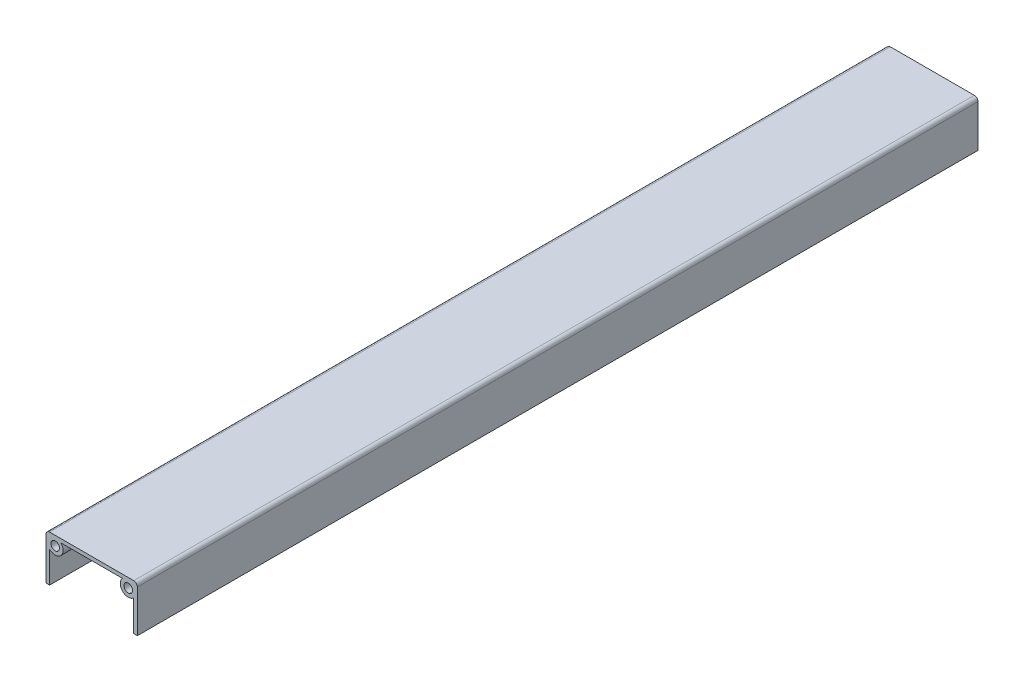
from build123d import *

# Parameters (mm, degrees)
SKETCH1_W           = 63.5
SKETCH1_H           = 63.5
SKETCH1_R           = 3
BOSS_EXTRUDE1_DEPTH = 292.1
FILLET1_R           = 2.54
SHELL1_START        = -292.1
SHELL1_DEPTH        = 584.2
SKETCH3_W           = 63.665273771
SKETCH3_H           = 31.75
CUT_EXTRUDE2_DEPTH  = 586.923002621


# Read off the part's stored shape, not the designer's step: Shell1
with BuildPart() as part:
    # Sketch1 → Boss-Extrude1 (new, symmetric)
    with BuildSketch(Plane.XY):
        Rectangle(SKETCH1_W, SKETCH1_H)
        with Locations((-25.4, 25.4)):
            Circle(SKETCH1_R, mode=Mode.SUBTRACT)
        with Locations(Location((25.4, -25.4, 0), (0, 0, 180))):
            Circle(SKETCH1_R, mode=Mode.SUBTRACT)
        with Locations(Location((-25.4, -25.4, 0), (0, 0, 180))):
            Circle(SKETCH1_R, mode=Mode.SUBTRACT)
        with Locations(Location((25.4, 25.4, 0), (0, 0, 180))):
            Circle(SKETCH1_R, mode=Mode.SUBTRACT)
    extrude(amount=BOSS_EXTRUDE1_DEPTH, both=True)

    # Fillet1
    fillet1_edges = [part.edges().sort_by_distance(p)[0] for p in [
        (31.75, -31.75, 0),
        (-31.75, -31.75, 0),
        (-31.75, 31.75, 0),
        (31.75, 31.75, 0),
    ]]
    fillet(fillet1_edges, radius=FILLET1_R)

    # Shell1 outline → Shell1 (cut)
    with BuildSketch(Plane.XY.offset(SHELL1_START)):
        with BuildLine():
            Line((29.21, -21.378122329), (29.21, 21.378122329))
            ThreePointArc((29.21, 21.378122329), (21.482628432, 21.482628432), (21.378122329, 29.21))
            Line((21.378122329, 29.21), (-21.378122329, 29.21))
            ThreePointArc((-21.378122329, 29.21), (-21.482628432, 21.482628432), (-29.21, 21.378122329))
            Line((-29.21, 21.378122329), (-29.21, -21.378122329))
            ThreePointArc((-29.21, -21.378122329), (-21.482628432, -21.482628432), (-21.378122329, -29.21))
            Line((-21.378122329, -29.21), (21.378122329, -29.21))
            ThreePointArc((21.378122329, -29.21), (21.482628432, -21.482628432), (29.21, -21.378122329))
        make_face()
    extrude(amount=SHELL1_DEPTH, mode=Mode.SUBTRACT)

    # Sketch3 → Cut-Extrude2 (cut, through all)
    with BuildSketch(Plane.XY.offset(292.1)):
        with Locations((0.082636885, -16.003852467)):
            Rectangle(SKETCH3_W, SKETCH3_H)
    extrude(amount=-CUT_EXTRUDE2_DEPTH, mode=Mode.SUBTRACT)


solid = part.part
